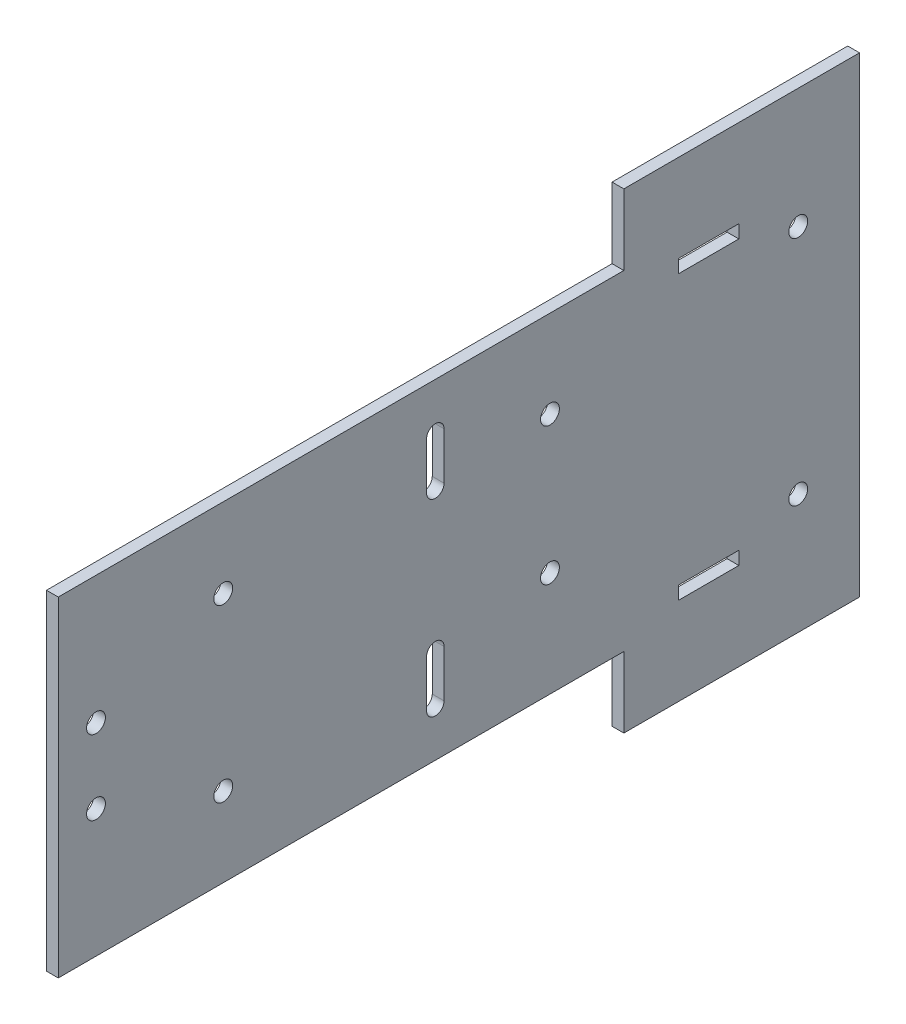
from build123d import *

# Parameters (mm, degrees)
BOSS_EXTRUDE1_DEPTH = 2.5
SKETCH4_W           = 2.8
SKETCH4_H           = 12.8
CUT_EXTRUDE1_DEPTH  = 178.218085984
CUT_EXTRUDE2_DEPTH  = 178.218085984
SKETCH7_R           = 2
CUT_EXTRUDE3_DEPTH  = 178.218085984
SKETCH8_R           = 2
CUT_EXTRUDE4_DEPTH  = 178.218085984
SKETCH9_R           = 2
CUT_EXTRUDE5_DEPTH  = 178.218085984


with BuildPart() as part:
    # Sketch1 → Boss-Extrude1 (new body)
    with BuildSketch(Plane.YZ):
        Polygon((50, 0), (50, 50), (35, 50), (35, 170), (-35, 170), (-35, 50), (-50, 50), (-50, 0), (0, 0), align=None)
    extrude(amount=BOSS_EXTRUDE1_DEPTH)

    # Sketch4 → Cut-Extrude1 (cut, through all)
    with BuildSketch(Plane(origin=(0, 0, 0), x_dir=(0, -1, 0), z_dir=(-1, 0, 0))):
        with Locations((-30, 32)):
            Rectangle(SKETCH4_W, SKETCH4_H)
        with Locations((30, 32)):
            Rectangle(SKETCH4_W, SKETCH4_H)
    extrude(amount=-CUT_EXTRUDE1_DEPTH, mode=Mode.SUBTRACT)

    # Sketch6 → Cut-Extrude2 (cut, through all)
    with BuildSketch(Plane(origin=(0, 0, 0), x_dir=(0, -1, 0), z_dir=(-1, 0, 0))):
        with BuildLine():
            Line((-25, 91.85), (-15, 91.85))
            ThreePointArc((-15, 91.85), (-13.15, 90), (-15, 88.15))
            Line((-15, 88.15), (-25, 88.15))
            ThreePointArc((-25, 88.15), (-26.85, 90), (-25, 91.85))
        make_face()
        with BuildLine():
            Line((15, 91.85), (25, 91.85))
            ThreePointArc((25, 91.85), (26.85, 90), (25, 88.15))
            Line((25, 88.15), (15, 88.15))
            ThreePointArc((15, 88.15), (13.15, 90), (15, 91.85))
        make_face()
    extrude(amount=-CUT_EXTRUDE2_DEPTH, mode=Mode.SUBTRACT)

    # Sketch7 → Cut-Extrude3 (cut, through all)
    with BuildSketch(Plane.YZ.offset(2.5)):
        with Locations((-18.15, 135)):
            Circle(SKETCH7_R)
        with Locations((18.15, 135)):
            Circle(SKETCH7_R)
    extrude(amount=-CUT_EXTRUDE3_DEPTH, mode=Mode.SUBTRACT)

    # Sketch8 → Cut-Extrude4 (cut, through all)
    with BuildSketch(Plane(origin=(0, 0, 0), x_dir=(0, -1, 0), z_dir=(-1, 0, 0))):
        with Locations((-7.9, 162)):
            Circle(SKETCH8_R)
        with Locations((7.9, 162)):
            Circle(SKETCH8_R)
    extrude(amount=-CUT_EXTRUDE4_DEPTH, mode=Mode.SUBTRACT)

    # Sketch9 → Cut-Extrude5 (cut, through all)
    with BuildSketch(Plane.YZ.offset(2.5)):
        with Locations((-24.585, 13)):
            Circle(SKETCH9_R)
        with Locations((24.585, 13)):
            Circle(SKETCH9_R)
        with Locations((16.456811594, 65.676584487)):
            Circle(SKETCH9_R)
        with Locations((-12.703188406, 65.676584487)):
            Circle(SKETCH9_R)
    extrude(amount=-CUT_EXTRUDE5_DEPTH, mode=Mode.SUBTRACT)


solid = part.part
